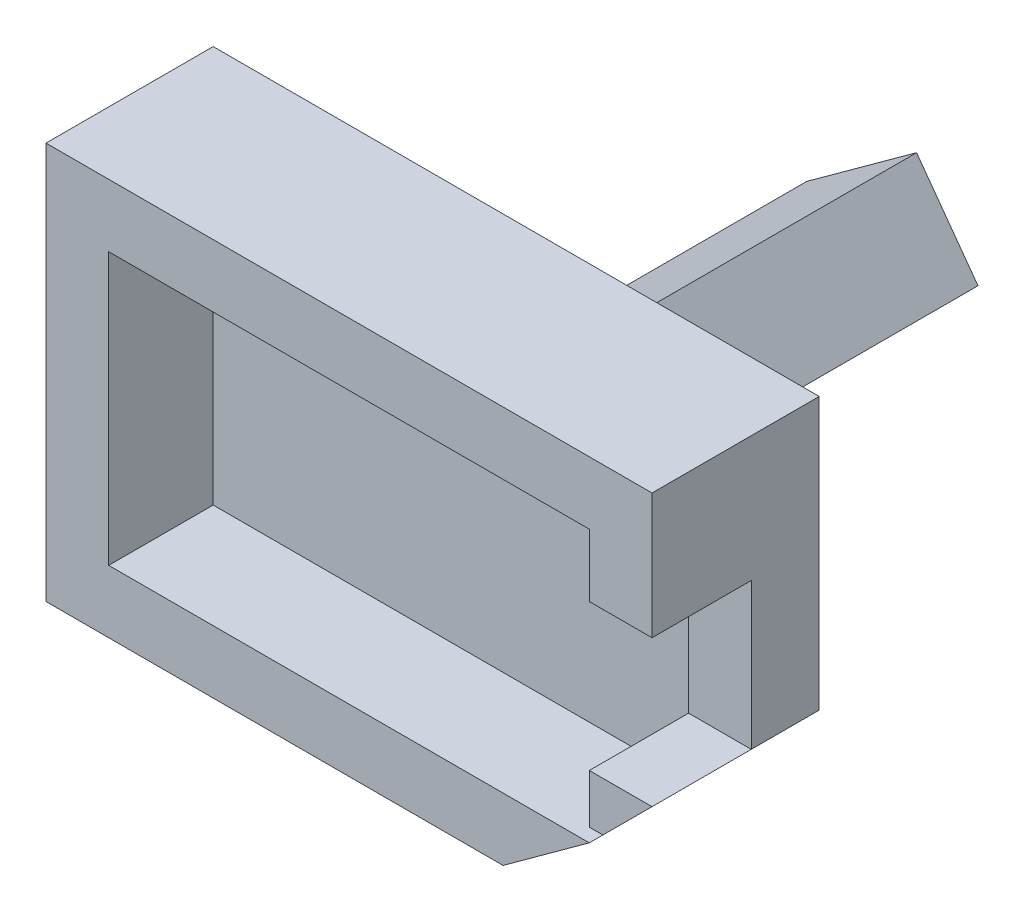
from build123d import *

# Parameters (mm, degrees)
BOSS_EXTRUDE1_DEPTH = 3
BOSS_EXTRUDE2_DEPTH = 5
BOSS_EXTRUDE3_DEPTH = 18
SKETCH4_W           = 4.75
SKETCH4_H           = 7
CUT_EXTRUDE1_DEPTH  = 8


with BuildPart() as part:
    # Sketch1 → Boss-Extrude1 (new body)
    with BuildSketch(Plane.XY):
        Polygon((7.370854239, -9.5), (-14.5, -9.5), (-14.5, 9.5), (14.5, 9.5), (14.5, -3.5), (11.5, -6.5), align=None)
    extrude(amount=BOSS_EXTRUDE1_DEPTH)

    # Sketch2 → Boss-Extrude2 (add)
    with BuildSketch(Plane.XY.offset(3)):
        Polygon((14.5, -3.5), (12.151215505, -5.848784495), (11.5, -5.848784495), (11.5, 6.5), (-11.5, 6.5), (-11.5, -6.5), (11.5, -6.5), (7.370854239, -9.5), (-14.5, -9.5), (-14.5, 9.5), (14.5, 9.5), align=None)
    extrude(amount=BOSS_EXTRUDE2_DEPTH)

    # Sketch3 → Boss-Extrude3 (add)
    with BuildSketch(Plane(origin=(0, 0, 0), x_dir=(-1, 0, 0), z_dir=(0, 0, -1))):
        Polygon((-1.159842101, 3.932844556), (4.098768362, 0.112240416), (1.159842101, -3.932844556), (-4.098768362, -0.112240416), align=None)
    extrude(amount=BOSS_EXTRUDE3_DEPTH)

    # Sketch4 → Cut-Extrude1 (cut)
    with BuildSketch(Plane(origin=(14.5, 0, 0), x_dir=(0, 0, -1), z_dir=(1, 0, 0))):
        with Locations((-5.625, 0)):
            Rectangle(SKETCH4_W, SKETCH4_H)
    extrude(amount=-CUT_EXTRUDE1_DEPTH, mode=Mode.SUBTRACT)


solid = part.part
